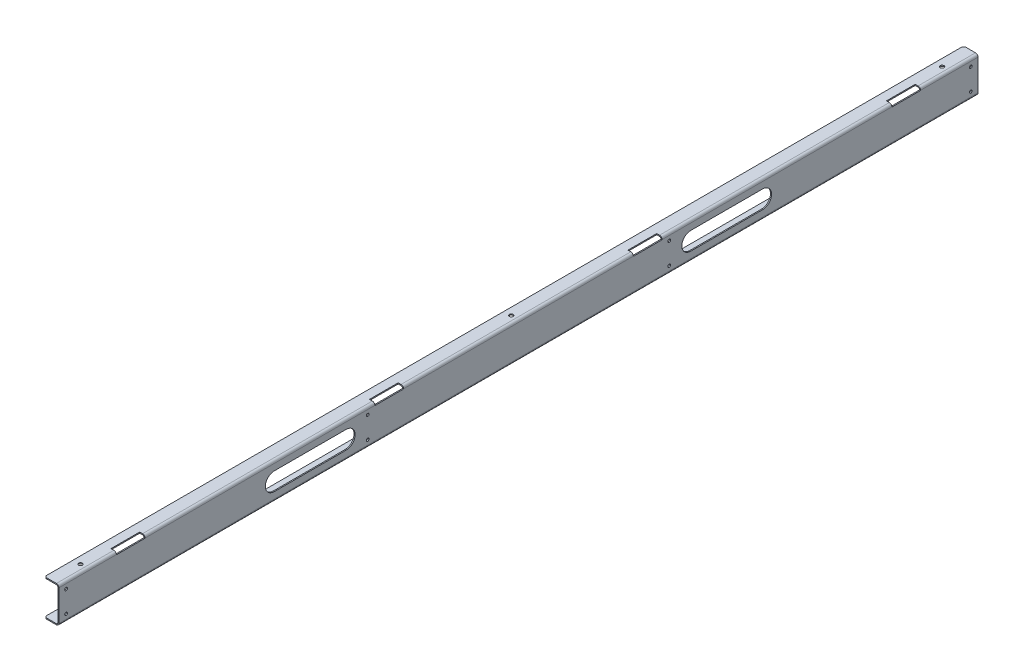
from build123d import *

# Parameters (mm, degrees)
SKETCH1_W                      = 1625.6
SKETCH1_H                      = 63.5
BASE_FLANGE1_DEPTH             = 1.89738
EDGE_FLANGE1_STRIP_W           = 12.66952
EDGE_FLANGE1_STRIP_H           = 1.89738
EDGE_FLANGE1_STRIP_CUT_DEPTH   = 1625.6
EDGE_FLANGE1_STRIP_2_W         = 12.66952
EDGE_FLANGE1_STRIP_2_H         = 1.89738
EDGE_FLANGE1_STRIP_CUT_2_DEPTH = 1625.6
EDGE_FLANGE1_DEPTH             = 1625.6
EDGE_FLANGE1_BEND_DEPTH        = 1625.6
SKETCH15_W                     = 9.525
SKETCH15_H                     = 50.8
CUT_EXTRUDE2_DEPTH             = 4.7752
LPATTERN3_COUNT                = 4
LPATTERN3_PITCH                = 457.2
SKETCH16_R                     = 3.3655
CUT_EXTRUDE3_DEPTH             = 2.54
LPATTERN4_COUNT                = 3
LPATTERN4_PITCH                = 762
CUT_EXTRUDE4_DEPTH             = 2.54
LPATTERN5_COUNT                = 2
LPATTERN5_PITCH                = 736.6
SKETCH18_R                     = 2.4638
CUT_EXTRUDE5_DEPTH             = 1628.038035818
SKETCH19_R                     = 2.4638
CUT_EXTRUDE6_DEPTH             = 1628.038035818
CHAMFER1_SIZE                  = 2.54


# Sheet-metal steps are written as plain solids
with BuildPart() as part:
    # Sketch1 → Base-Flange1 (new body)
    with BuildSketch(Plane(origin=(0, 0, 0), x_dir=(0, 0, -1), z_dir=(1, 0, 0))):
        with Locations((812.8, 31.75)):
            Rectangle(SKETCH1_W, SKETCH1_H)
    extrude(amount=-BASE_FLANGE1_DEPTH)

    # Edge-Flange1 strip (across the edge) → Edge-Flange1 strip cut (cut)
    with BuildSketch(Plane(origin=(-1.89738, 63.5, 0), x_dir=(0, -1, 0), z_dir=(0, 0, -1))):
        with Locations((-1.89738, -0.94869)):
            Rectangle(EDGE_FLANGE1_STRIP_W, EDGE_FLANGE1_STRIP_H)
    extrude(amount=EDGE_FLANGE1_STRIP_CUT_DEPTH, mode=Mode.SUBTRACT)

    # Edge-Flange1 strip 2 (across the edge) → Edge-Flange1 strip cut 2 (cut)
    with BuildSketch(Plane(origin=(-1.89738, 0, -1625.6), x_dir=(0, 1, 0), z_dir=(0, 0, 1))):
        with Locations((-1.89738, -0.94869)):
            Rectangle(EDGE_FLANGE1_STRIP_2_W, EDGE_FLANGE1_STRIP_2_H)
    extrude(amount=EDGE_FLANGE1_STRIP_CUT_2_DEPTH, mode=Mode.SUBTRACT)

    # Edge-Flange1 section (across the edge) → Edge-Flange1 (add)
    with BuildSketch(Plane(origin=(-1.89738, 63.5, 0), x_dir=(0, -1, 0), z_dir=(0, 0, -1))):
        with BuildLine():
            Line((0, 2.54), (0, 23.50262))
            Line((0, 23.50262), (1.89738, 23.50262))
            Line((1.89738, 23.50262), (1.89738, 2.54))
            ThreePointArc((1.89738, 2.54), (2.641328776, 0.743948776), (4.43738, 0))
            Line((4.43738, 0), (4.43738, -1.89738))
            ThreePointArc((4.43738, -1.89738), (1.299678511, -0.597701489), (0, 2.54))
        make_face()
    extrude(amount=EDGE_FLANGE1_DEPTH)

    # Edge-Flange1 section 2 (across the edge) → Edge-Flange1 bend (add)
    with BuildSketch(Plane(origin=(-1.89738, 0, -1625.6), x_dir=(0, 1, 0), z_dir=(0, 0, 1))):
        with BuildLine():
            Line((0, 2.54), (0, 23.50262))
            Line((0, 23.50262), (1.89738, 23.50262))
            Line((1.89738, 23.50262), (1.89738, 2.54))
            ThreePointArc((1.89738, 2.54), (2.641328776, 0.743948776), (4.43738, 0))
            Line((4.43738, 0), (4.43738, -1.89738))
            ThreePointArc((4.43738, -1.89738), (1.299678511, -0.597701489), (0, 2.54))
        make_face()
    extrude(amount=EDGE_FLANGE1_BEND_DEPTH)

    # Sketch15 → Cut-Extrude2 (cut)
    with BuildSketch(Plane(origin=(0, 63.5, 0), x_dir=(1, 0, 0), z_dir=(0, 1, 0))):
        with Locations((-4.7625, 127)):
            Rectangle(SKETCH15_W, SKETCH15_H)
    cut_extrude2 = extrude(amount=-CUT_EXTRUDE2_DEPTH, mode=Mode.SUBTRACT)

    # LPattern3: Cut-Extrude2 ×4
    with Locations(*[(0, 0, -i * LPATTERN3_PITCH) for i in range(1, LPATTERN3_COUNT)]):
        add(cut_extrude2, mode=Mode.SUBTRACT)

    # Sketch16 → Cut-Extrude3 (cut)
    with BuildSketch(Plane(origin=(0, 63.5, 0), x_dir=(1, 0, 0), z_dir=(0, 1, 0))):
        with Locations(Location((-12.7, 1574.8, 0), (0, 0, 180))):
            Circle(SKETCH16_R)
    cut_extrude3 = extrude(amount=-CUT_EXTRUDE3_DEPTH, mode=Mode.SUBTRACT)

    # LPattern4: Cut-Extrude3 ×3
    with Locations(*[(0, 0, i * LPATTERN4_PITCH) for i in range(1, LPATTERN4_COUNT)]):
        add(cut_extrude3, mode=Mode.SUBTRACT)

    # Sketch17 → Cut-Extrude4 (cut)
    with BuildSketch(Plane(origin=(0, 0, 0), x_dir=(0, 0, -1), z_dir=(1, 0, 0))):
        with BuildLine():
            Line((381, 47.625), (508, 47.625))
            ThreePointArc((508, 47.625), (523.875, 31.75), (508, 15.875))
            Line((508, 15.875), (381, 15.875))
            ThreePointArc((381, 15.875), (365.125, 31.75), (381, 47.625))
        make_face()
    cut_extrude4 = extrude(amount=-CUT_EXTRUDE4_DEPTH, mode=Mode.SUBTRACT)

    # LPattern5: Cut-Extrude4 ×2
    with Locations(*[(0, 0, -i * LPATTERN5_PITCH) for i in range(1, LPATTERN5_COUNT)]):
        add(cut_extrude4, mode=Mode.SUBTRACT)

    # Sketch18 → Cut-Extrude5 (cut, through all)
    with BuildSketch(Plane(origin=(0, 0, 0), x_dir=(0, 0, -1), z_dir=(1, 0, 0))):
        with Locations((546.1, 50.8)):
            Circle(SKETCH18_R)
        with Locations((546.1, 12.7)):
            Circle(SKETCH18_R)
    cut_extrude5 = extrude(amount=-CUT_EXTRUDE5_DEPTH, mode=Mode.SUBTRACT)

    # Sketch19 → Cut-Extrude6 (cut, through all)
    with BuildSketch(Plane(origin=(0, 0, 0), x_dir=(0, 0, -1), z_dir=(1, 0, 0))):
        with Locations((12.7, 50.8)):
            Circle(SKETCH19_R)
        with Locations((12.7, 12.7)):
            Circle(SKETCH19_R)
    cut_extrude6 = extrude(amount=-CUT_EXTRUDE6_DEPTH, mode=Mode.SUBTRACT)

    # Mirror1: Cut-Extrude5, Cut-Extrude6 across plane
    add(cut_extrude5.mirror(Plane.XY.offset(-812.8)), mode=Mode.SUBTRACT)
    add(cut_extrude6.mirror(Plane.XY.offset(-812.8)), mode=Mode.SUBTRACT)

    # Chamfer1
    chamfer1_edges = [part.edges().sort_by_distance(p)[0] for p in [
        (-25.4, 62.55131, 0),
        (-25.4, 62.55131, -1625.6),
        (-25.4, 0.94869, -1625.6),
        (-25.4, 0.94869, 0),
    ]]
    chamfer(chamfer1_edges, length=CHAMFER1_SIZE)


solid = part.part
